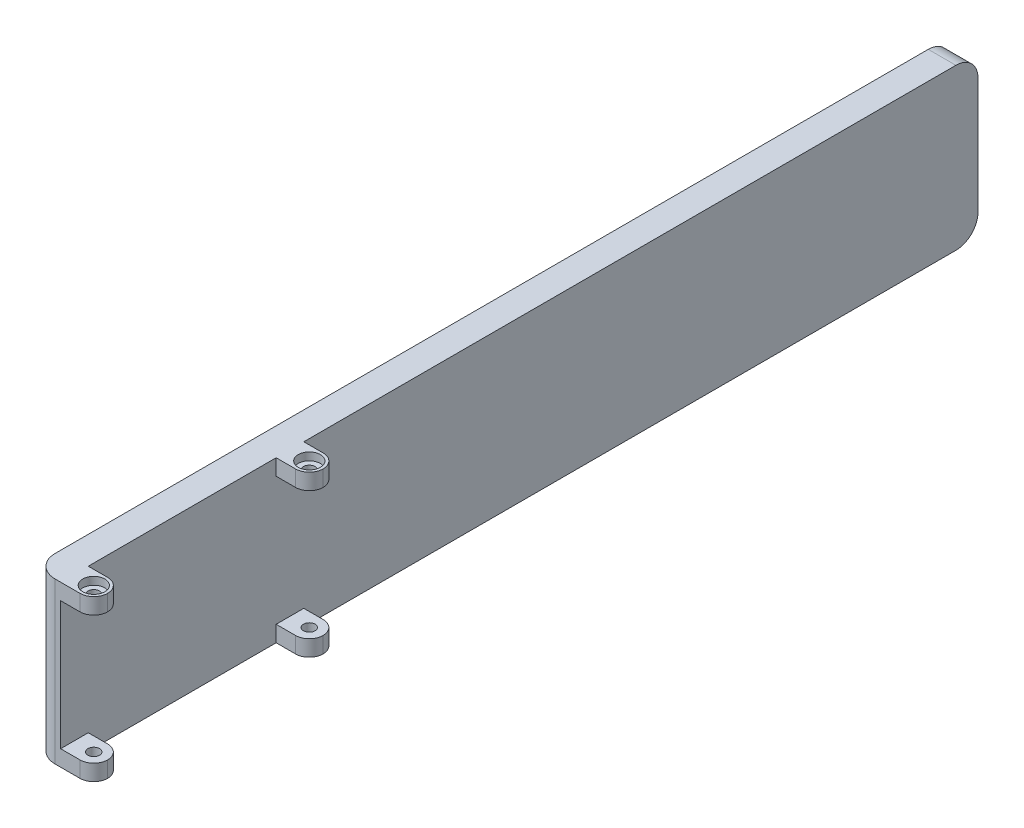
from build123d import *

# Parameters (mm, degrees)
SKETCH1_W           = 5
SKETCH1_H           = 166
BOSS_EXTRUDE1_DEPTH = 29
SKETCH2_W           = 5
SKETCH2_H           = 2.9
BOSS_EXTRUDE2_DEPTH = 6
SKETCH3_R           = 1.05
CUT_EXTRUDE1_DEPTH  = 169.620876525
SKETCH4_R           = 2
CUT_EXTRUDE2_DEPTH  = 1.4
FILLET1_R           = 4
FILLET2_R           = 2.5


with BuildPart() as part:
    # Sketch1 → Boss-Extrude1 (new body)
    with BuildSketch(Plane(origin=(0, 0, 0), x_dir=(1, 0, 0), z_dir=(0, 1, 0))):
        with Locations((-2.5, 83)):
            Rectangle(SKETCH1_W, SKETCH1_H)
    extrude(amount=BOSS_EXTRUDE1_DEPTH)

    # Sketch2 → Boss-Extrude2 (add)
    with BuildSketch(Plane(origin=(0, 0, 0), x_dir=(0, 0, -1), z_dir=(1, 0, 0))):
        with Locations((2.5, 27.55)):
            Rectangle(SKETCH2_W, SKETCH2_H)
        with Locations((41.5, 27.55)):
            Rectangle(SKETCH2_W, SKETCH2_H)
        with Locations((41.5, 1.45)):
            Rectangle(SKETCH2_W, SKETCH2_H)
        with Locations((2.5, 1.45)):
            Rectangle(SKETCH2_W, SKETCH2_H)
    extrude(amount=BOSS_EXTRUDE2_DEPTH)

    # Sketch3 → Cut-Extrude1 (cut, through all)
    with BuildSketch(Plane(origin=(0, 29, 0), x_dir=(1, 0, 0), z_dir=(0, 1, 0))):
        with Locations(Location((3.5, 41.5, 0), (0, 0, 270))):
            Circle(SKETCH3_R)
        with Locations(Location((3.5, 2.5, 0), (0, 0, 270))):
            Circle(SKETCH3_R)
    extrude(amount=-CUT_EXTRUDE1_DEPTH, mode=Mode.SUBTRACT)

    # Sketch4 → Cut-Extrude2 (cut)
    with BuildSketch(Plane(origin=(0, 29, 0), x_dir=(1, 0, 0), z_dir=(0, 1, 0))):
        with Locations(Location((3.5, 41.5, 0), (0, 0, 270))):
            Circle(SKETCH4_R)
        with Locations(Location((3.5, 2.5, 0), (0, 0, 270))):
            Circle(SKETCH4_R)
    cut_extrude2 = extrude(amount=-CUT_EXTRUDE2_DEPTH, mode=Mode.SUBTRACT)

    # Mirror2: Cut-Extrude2 across plane
    add(cut_extrude2.mirror(Plane.ZX.offset(14.5)), mode=Mode.SUBTRACT)

    # Fillet1
    fillet1_edges = [part.edges().sort_by_distance(p)[0] for p in [
        (-2.5, 0, -166),
        (-5, 14.5, 0),
        (-2.5, 29, -166),
    ]]
    fillet(fillet1_edges, radius=FILLET1_R)

    # Fillet2
    fillet2_edges = [part.edges().sort_by_distance(p)[0] for p in [
        (6, 1.45, -5),
        (6, 1.45, 0),
        (6, 1.45, -44),
        (6, 1.45, -39),
        (6, 27.55, -44),
        (6, 27.55, -39),
        (6, 27.55, -5),
        (6, 27.55, 0),
    ]]
    fillet(fillet2_edges, radius=FILLET2_R - 0.0001)  # a hair under: the kernel refuses the full size


solid = part.part
